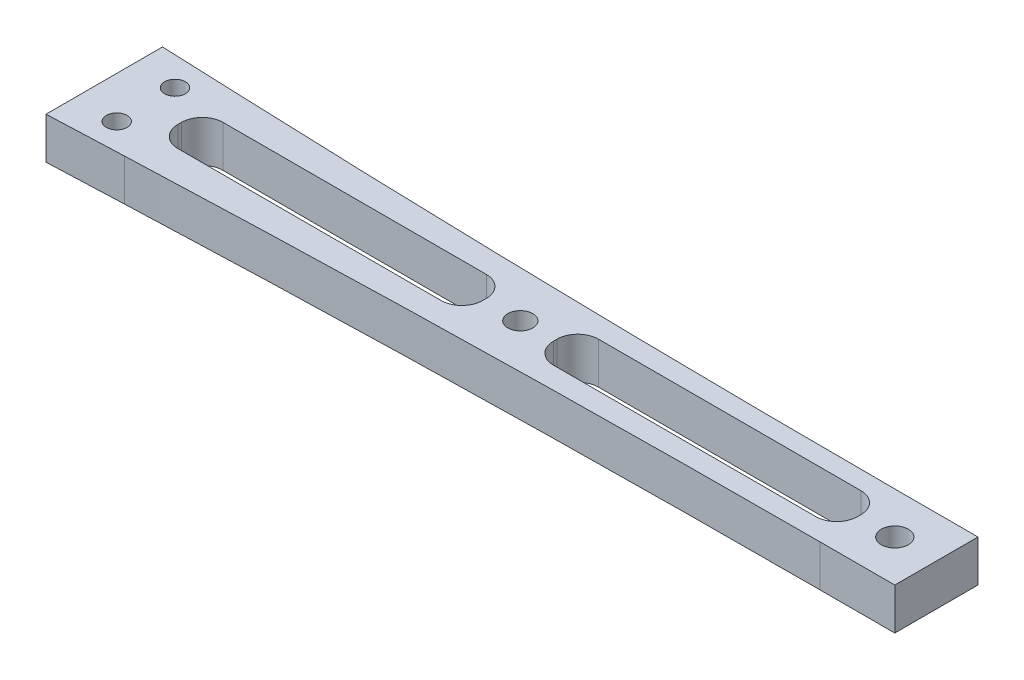
from build123d import *

# Parameters (mm, degrees)
SZKIC1_R                    = 3
SZKIC1_R_2                  = 3.25
SZKIC1_R_3                  = 2.5
DODANIE_WYCI_GNI_CIE1_DEPTH = 10
ZAOKR_GLENIE1_R             = 4100


with BuildPart() as part:
    # Szkic1 → Dodanie-wyciągnięcie1 (new body)
    with BuildSketch(Plane(origin=(0, 0, 0), x_dir=(1, 0, 0), z_dir=(0, 1, 0))):
        Polygon((200, 0), (200, 20), (100, 20), (0, 24), (0, -4), (100, 0), align=None)
        with Locations(Location((100, 10, 0), (0, 0, 270))):
            Circle(SZKIC1_R, mode=Mode.SUBTRACT)
        with Locations(Location((190, 10, 0), (0, 0, 270))):
            Circle(SZKIC1_R_2, mode=Mode.SUBTRACT)
        with Locations(Location((10, 17, 0), (0, 0, 270))):
            Circle(SZKIC1_R_3, mode=Mode.SUBTRACT)
        with Locations(Location((10, 3, 0), (0, 0, 270))):
            Circle(SZKIC1_R_3, mode=Mode.SUBTRACT)
        with BuildLine():
            Line((22.984822323, 15.57457628), (86.25939238, 15.57457628))
            ThreePointArc((86.25939238, 15.57457628), (89.794926286, 14.110110186), (91.25939238, 10.57457628))
            Line((91.25939238, 10.57457628), (91.25939238, 9.696719379))
            ThreePointArc((91.25939238, 9.696719379), (89.794926286, 6.161185473), (86.25939238, 4.696719379))
            Line((86.25939238, 4.696719379), (22.984822323, 4.696719379))
            ThreePointArc((22.984822323, 4.696719379), (19.449288417, 6.161185473), (17.984822323, 9.696719379))
            Line((17.984822323, 9.696719379), (17.984822323, 10.57457628))
            ThreePointArc((17.984822323, 10.57457628), (19.449288417, 14.110110186), (22.984822323, 15.57457628))
        make_face(mode=Mode.SUBTRACT)
        with BuildLine():
            Line((113.225148066, 15.57457628), (176.286209663, 15.57457628))
            ThreePointArc((176.286209663, 15.57457628), (179.821743569, 14.110110186), (181.286209663, 10.57457628))
            Line((181.286209663, 10.57457628), (181.286209663, 9.752776346))
            ThreePointArc((181.286209663, 9.752776346), (179.821743569, 6.21724244), (176.286209663, 4.752776346))
            Line((176.286209663, 4.752776346), (113.225148066, 4.752776346))
            ThreePointArc((113.225148066, 4.752776346), (109.68961416, 6.21724244), (108.225148066, 9.752776346))
            Line((108.225148066, 9.752776346), (108.225148066, 10.57457628))
            ThreePointArc((108.225148066, 10.57457628), (109.68961416, 14.110110186), (113.225148066, 15.57457628))
        make_face(mode=Mode.SUBTRACT)
    extrude(amount=DODANIE_WYCI_GNI_CIE1_DEPTH)

    # Zaokrąglenie1
    # the kernel refuses this fillet: 4100 mm, written as the material it adds along each edge
    with BuildSketch(Plane(origin=(100, 0, -20), x_dir=(1, 0, 0), z_dir=(0, 1, 0)), Plane(origin=(100, 0, 0), x_dir=(-0.9992009587217893, 0, 0.03996803834887583), z_dir=(0, 1, 0))) as zaokr_glenie1_piece_1:
        with BuildLine():
            CenterArc((ZAOKR_GLENIE1_R * 0.0199920063936, ZAOKR_GLENIE1_R), ZAOKR_GLENIE1_R, 267.709389957, 2.290610043)
            Line((-ZAOKR_GLENIE1_R * 0.0199760319553, ZAOKR_GLENIE1_R * 0.000799041278211), (0, 0))
            Line((0, 0), (ZAOKR_GLENIE1_R * 0.0199920063936, 0))
        make_face()
    extrude(amount=10)


solid = part.part
